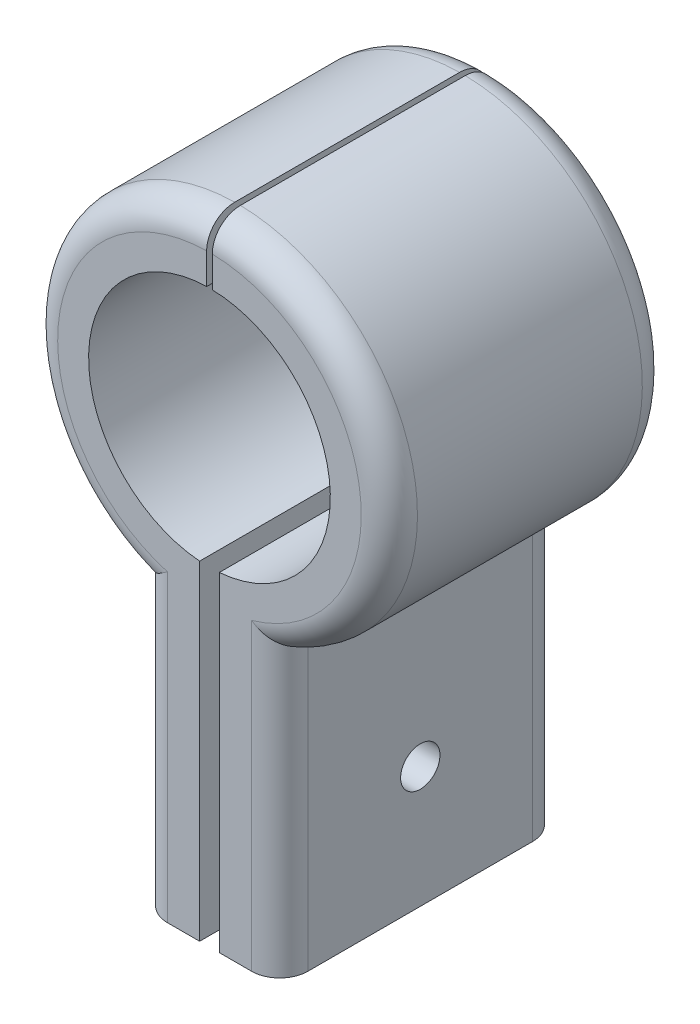
from build123d import *

# Parameters (mm, degrees)
BOSS_EXTRUDE1_DEPTH     = 25
BOSS_EXTRUDE1_2_DEPTH   = 25
FILLET1_R               = 5
FILLET2_R               = 5
CUT_EXTRUDE1_DEPTH      = 95.895995858
CUT_EXTRUDE1_DEPTH_BACK = 95.895995858
SKETCH3_R               = 3.5


with BuildPart() as part:
    # Sketch1 → Boss-Extrude1 (new, symmetric)
    with BuildSketch(Plane.XY):
        with BuildLine():
            Line((-12.5, -29.457596643), (-12.5, -80))
            Line((-12.5, -80), (-1.75, -80))
            Line((-1.75, -80), (-1.75, -21.428660714))
            ThreePointArc((-1.75, -21.428660714), (-21.490888805, 0.625858104), (-0.5, 21.49418526))
            Line((-0.5, 21.49418526), (-0.5, 31.996093512))
            ThreePointArc((-0.5, 31.996093512), (-31.406830601, 6.132780086), (-12.5, -29.457596643))
        make_face()
    extrude(amount=BOSS_EXTRUDE1_DEPTH, both=True)

    # Fillet1
    fillet1_edges = [part.edges().sort_by_distance(p)[0] for p in [
        (-31.406830601, 6.132780086, 25),
        (-31.406830601, 6.132780086, -25),
        (-12.5, -54.728798322, 25),
        (-12.5, -54.728798322, -25),
    ]]
    fillet(fillet1_edges, radius=FILLET1_R)


with BuildPart() as body_2:
    # Sketch1 → Boss-Extrude1 2 (new, symmetric)
    with BuildSketch(Plane.XY):
        with BuildLine():
            Line((12.5, -29.457596643), (12.5, -80))
            Line((12.5, -80), (1.75, -80))
            Line((1.75, -80), (1.75, -21.428660714))
            ThreePointArc((1.75, -21.428660714), (21.490888805, 0.625858104), (0.5, 21.49418526))
            Line((0.5, 21.49418526), (0.5, 31.996093512))
            ThreePointArc((0.5, 31.996093512), (31.406830601, 6.132780086), (12.5, -29.457596643))
        make_face()
    extrude(amount=BOSS_EXTRUDE1_2_DEPTH, both=True)

    # Fillet2
    fillet2_edges = [body_2.edges().sort_by_distance(p)[0] for p in [
        (31.406830601, 6.132780086, -25),
        (12.5, -54.728798322, -25),
        (12.5, -54.728798322, 25),
        (31.406830601, 6.132780086, 25),
    ]]
    fillet(fillet2_edges, radius=FILLET2_R)


with BuildPart() as cut_extrude1_tool:
    # Sketch3 → Cut-Extrude1 (new, two sides: drawn at the far end of the back side and taken through both)
    with BuildSketch(Plane.ZY.offset(12.5).offset(-CUT_EXTRUDE1_DEPTH_BACK)):
        with Locations((0, -58.449649017)):
            Circle(SKETCH3_R)
    extrude(amount=CUT_EXTRUDE1_DEPTH + CUT_EXTRUDE1_DEPTH_BACK)


with BuildPart() as part_1:
    add(part.part)

    # Cut-Extrude1: cut by cut_extrude1_tool
    add(cut_extrude1_tool.part, mode=Mode.SUBTRACT)


with BuildPart() as body_2_1:
    add(body_2.part)

    # Cut-Extrude1: cut by cut_extrude1_tool
    add(cut_extrude1_tool.part, mode=Mode.SUBTRACT)


solid = Compound([part_1.part, body_2_1.part])
